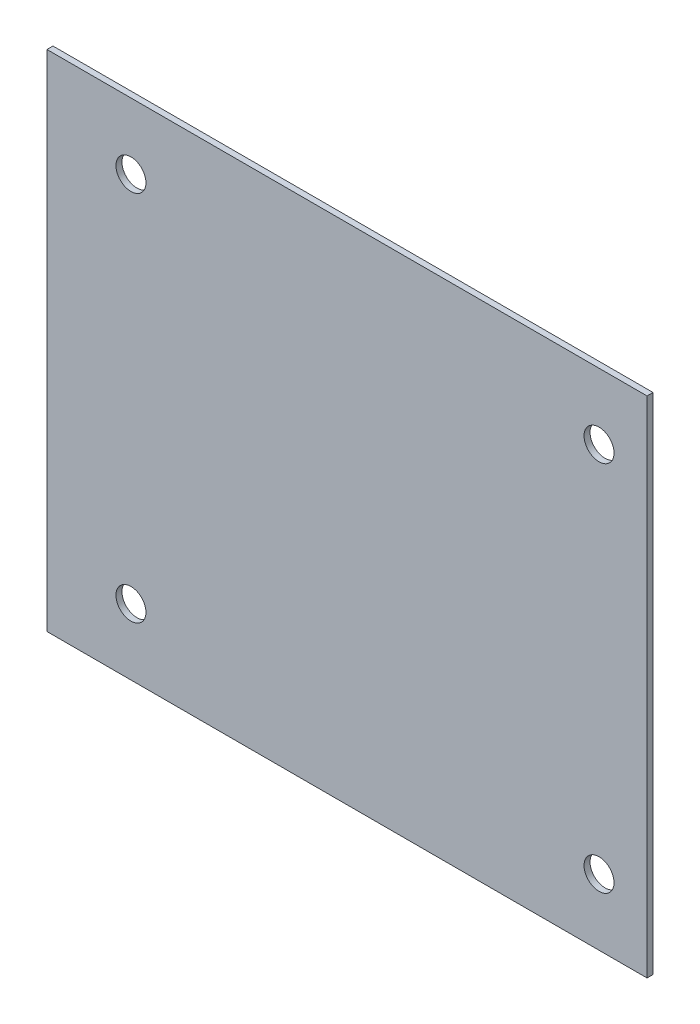
from build123d import *

# Parameters (mm, degrees)
SKETCH1_W           = 100
SKETCH1_H           = 84
SKETCH1_R           = 2.5
BOSS_EXTRUDE1_DEPTH = 1


with BuildPart() as part:
    # Sketch1 → Boss-Extrude1 (new body)
    with BuildSketch(Plane.XY):
        Rectangle(SKETCH1_W, SKETCH1_H)
        with Locations((42, -31)):
            Circle(SKETCH1_R, mode=Mode.SUBTRACT)
        with Locations((42, 31)):
            Circle(SKETCH1_R, mode=Mode.SUBTRACT)
        with Locations((-36, 31)):
            Circle(SKETCH1_R, mode=Mode.SUBTRACT)
        with Locations((-36, -31)):
            Circle(SKETCH1_R, mode=Mode.SUBTRACT)
    extrude(amount=BOSS_EXTRUDE1_DEPTH)


solid = part.part
